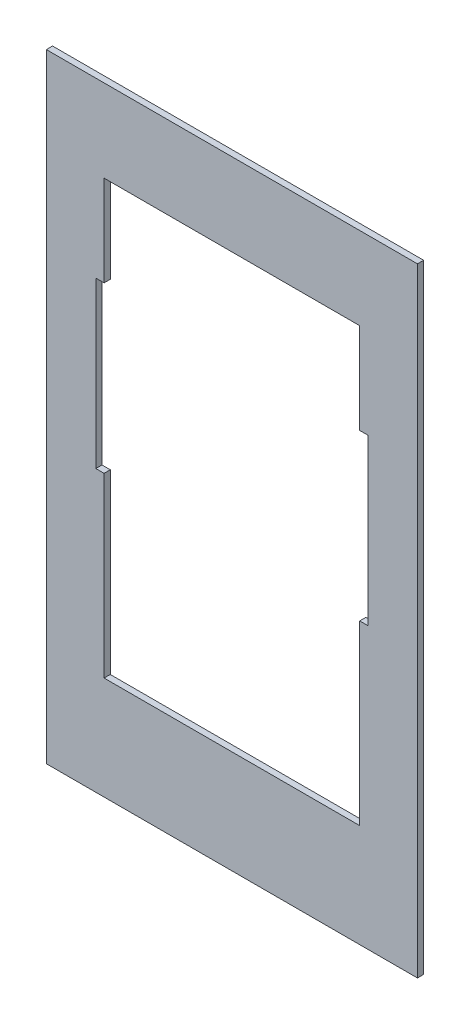
from build123d import *

# Parameters (mm, degrees)
SKETCH1_W           = 90
SKETCH1_H           = 150
BOSS_EXTRUDE1_DEPTH = 1.5


with BuildPart() as part:
    # Sketch1 → Boss-Extrude1 (new body)
    with BuildSketch(Plane.XY):
        Rectangle(SKETCH1_W, SKETCH1_H)
        Polygon((-31, -7), (-31, -50), (31, -50), (31, -7), (33, -7), (33, 33), (31, 33), (31, 55), (-31, 55), (-31, 33), (-33, 33), (-33, -7), align=None, mode=Mode.SUBTRACT)
    extrude(amount=BOSS_EXTRUDE1_DEPTH)


solid = part.part
